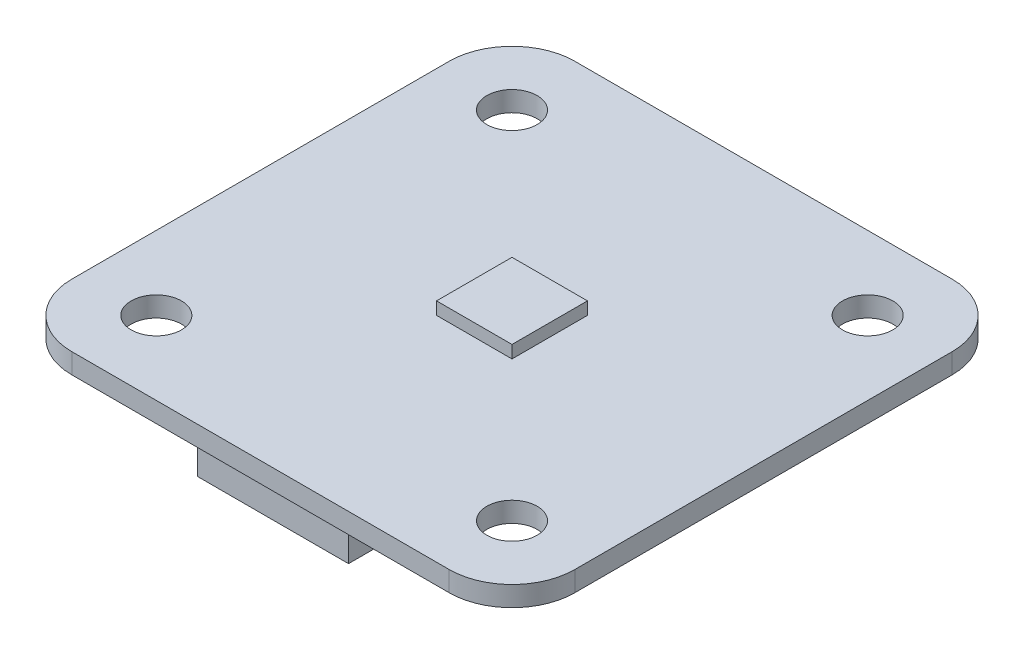
from build123d import *

# Parameters (mm, degrees)
SKETCH1_W           = 40
SKETCH1_H           = 40
BOSS_EXTRUDE1_DEPTH = 1.6
FILLET1_R           = 5
SKETCH2_R           = 2
CUT_EXTRUDE1_DEPTH  = 1.6
SKETCH3_W           = 6
SKETCH3_H           = 6
BOSS_EXTRUDE2_DEPTH = 1
SKETCH4_W           = 12
SKETCH4_H           = 8
BOSS_EXTRUDE3_DEPTH = 3


with BuildPart() as part:
    # Sketch1 → Boss-Extrude1 (new body)
    with BuildSketch(Plane(origin=(0, 0, 0), x_dir=(1, 0, 0), z_dir=(0, 1, 0))):
        Rectangle(SKETCH1_W, SKETCH1_H)
    extrude(amount=BOSS_EXTRUDE1_DEPTH)

    # Fillet1
    fillet1_edges = [part.edges().sort_by_distance(p)[0] for p in [
        (-20, 0.8, -20),
        (-20, 0.8, 20),
        (20, 0.8, -20),
        (20, 0.8, 20),
    ]]
    fillet(fillet1_edges, radius=FILLET1_R)

    # Sketch2 → Cut-Extrude1 (cut)
    with BuildSketch(Plane(origin=(0, 1.6, 0), x_dir=(1, 0, 0), z_dir=(0, 1, 0))):
        with Locations((-14.142135624, 14.142135624)):
            Circle(SKETCH2_R)
        with Locations((14.142135624, 14.142135624)):
            Circle(SKETCH2_R)
        with Locations((-14.142135624, -14.142135624)):
            Circle(SKETCH2_R)
        with Locations((14.142135624, -14.142135624)):
            Circle(SKETCH2_R)
    extrude(amount=-CUT_EXTRUDE1_DEPTH, mode=Mode.SUBTRACT)

    # Sketch3 → Boss-Extrude2 (add)
    with BuildSketch(Plane(origin=(0, 1.6, 0), x_dir=(1, 0, 0), z_dir=(0, 1, 0))):
        Rectangle(SKETCH3_W, SKETCH3_H)
    extrude(amount=BOSS_EXTRUDE2_DEPTH)

    # Sketch4 → Boss-Extrude3 (add)
    with BuildSketch(Plane.XZ):
        with Locations((0, 15)):
            Rectangle(SKETCH4_W, SKETCH4_H)
    extrude(amount=BOSS_EXTRUDE3_DEPTH)


solid = part.part
